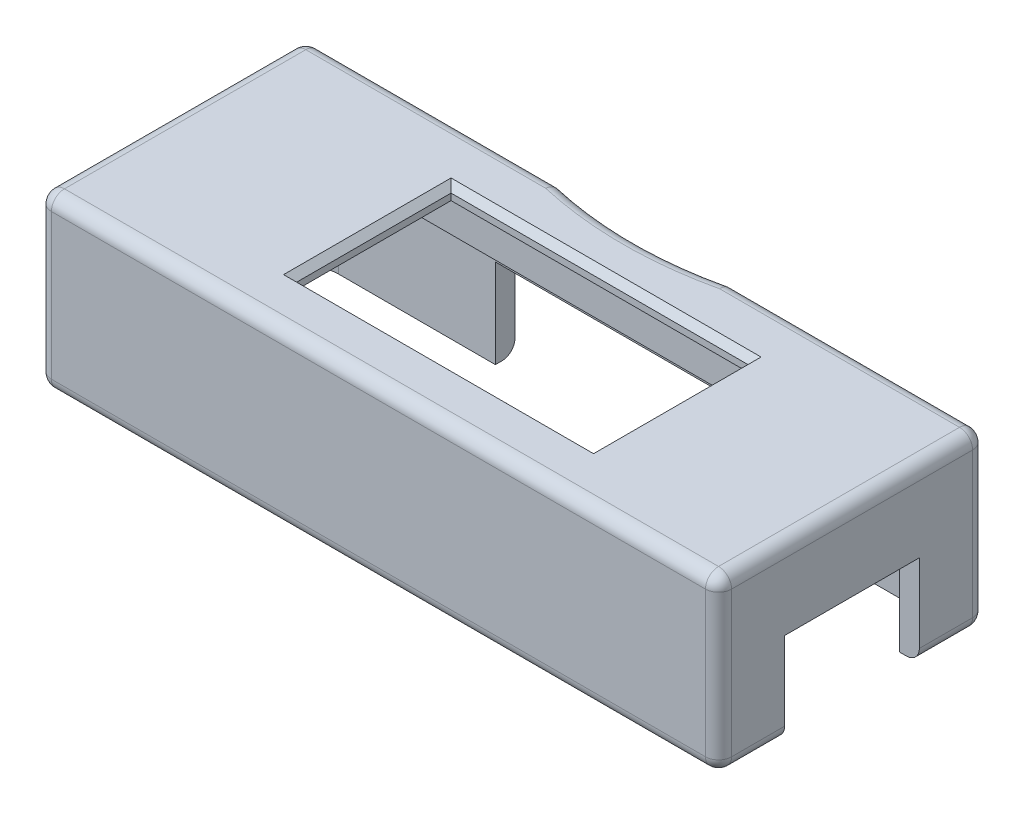
from build123d import *

# Parameters (mm, degrees)
EXTRUDE_1_DEPTH      = 13.1
CUT_EXTRUDE_1_DEPTH  = 1
CUT_EXTRUDE_2_DEPTH  = 3.5
CUT_EXTRUDE_3_DEPTH  = 11.5
SKETCH_7_R           = 1.2
CUT_EXTRUDE_4_DEPTH  = 3
CUT_EXTRUDE_5_DEPTH  = 3
SKETCH_17_W          = 10.3
SKETCH_17_H          = 7
CUT_EXTRUDE_7_DEPTH  = 3
SKETCH_23_R          = 28.905330341
CUT_EXTRUDE_16_DEPTH = 15
FILLET_1_R           = 1
FILLET_2_R           = 1
CHAMFER_1_SIZE       = 0.5
FILLET_3_R           = 1
SKETCH_24_W          = 2.140700812
SKETCH_24_H          = 3.70780257
CUT_EXTRUDE_17_DEPTH = 2
FILLET_4_R           = 1
CUT_EXTRUDE_18_DEPTH = 7
SKETCH_27_R          = 1.5
CUT_EXTRUDE_19_DEPTH = 2
CUT_EXTRUDE_20_DEPTH = 6.8


with BuildPart() as part:
    # 草图2 → 凸台-拉伸1 (new body)
    with BuildSketch(Plane(origin=(0, 0, 0), x_dir=(1, 0, 0), z_dir=(0, 1, 0))):
        Polygon((0.013768766, 20.433061971), (0, 0), (51.994397286, 0), (51.996083203, 20.418836971), align=None)
    extrude(amount=EXTRUDE_1_DEPTH)

    # 草图3 → 切除-拉伸1 (cut)
    with BuildSketch(Plane(origin=(0, 13.1, 0), x_dir=(1, 0, 0), z_dir=(0, 1, 0))):
        Polygon((15.554216141, 4.193063032), (38.254215601, 4.188106843), (38.256906278, 15.988112082), (15.556906819, 15.993072091), align=None)
    extrude(amount=-CUT_EXTRUDE_1_DEPTH, mode=Mode.SUBTRACT)

    # 草图4 → 切除-拉伸2 (cut)
    with BuildSketch(Plane(origin=(0, 12.1, 0), x_dir=(1, 0, 0), z_dir=(0, 1, 0))):
        Polygon((11.266979682, 17.10036488), (39.706985915, 17.101636261), (39.703966397, 3.081173841), (11.263967233, 3.087658824), align=None)
    extrude(amount=-CUT_EXTRUDE_2_DEPTH, mode=Mode.SUBTRACT)

    # 草图6 → 切除-拉伸3 (cut)
    with BuildSketch(Plane(origin=(0, 8.6, 0), x_dir=(1, 0, 0), z_dir=(0, 1, 0))):
        with BuildLine():
            Line((4.019496655, 18.931965744), (47.997410654, 18.919931154))
            ThreePointArc((47.997410654, 18.919931154), (49.765007767, 18.187296206), (50.496836532, 16.419365162))
            Line((50.496836532, 16.419365162), (50.493979096, 3.999425891))
            ThreePointArc((50.493979096, 3.999425891), (49.761344148, 2.231828778), (47.993413104, 1.500000013))
            Line((47.993413104, 1.500000013), (3.99352536, 1.500000013))
            ThreePointArc((3.99352536, 1.500000013), (2.225928247, 2.232634961), (1.494099482, 4.000566005))
            Line((1.494099482, 4.000566005), (1.518930662, 16.432539866))
            ThreePointArc((1.518930662, 16.432539866), (2.25156561, 18.200136979), (4.019496655, 18.931965744))
        make_face()
    extrude(amount=-CUT_EXTRUDE_3_DEPTH, mode=Mode.SUBTRACT)

    # 草图7 → 切除-拉伸4 (cut)
    with BuildSketch(Plane(origin=(0, 8.6, 0), x_dir=(1, 0, 0), z_dir=(0, 1, 0))):
        with Locations(Location((4.986997661, 16.769823075, 0), (0, 0, 270))):
            Circle(SKETCH_7_R)
        with Locations(Location((4.984007822, 3.657835416, 0), (0, 0, 270))):
            Circle(SKETCH_7_R)
        with Locations(Location((44.986916621, 16.760702161, 0), (0, 0, 270))):
            Circle(SKETCH_7_R)
        with Locations(Location((44.983926782, 3.648714502, 0), (0, 0, 270))):
            Circle(SKETCH_7_R)
    extrude(amount=CUT_EXTRUDE_4_DEPTH, mode=Mode.SUBTRACT)

    # 草图15 → 切除-拉伸5 (cut)
    with BuildSketch(Plane(origin=(0, 0, 0), x_dir=(-0.0006738472400635568, 0, 0.9999997729649228), z_dir=(-0.9999997729649228, 0, -0.0006738472400635568))):
        Polygon((-5.54, 3.59), (-10.21, 3.59), (-14.88, 3.59), (-14.88, 7.2), (-5.54, 7.2), align=None)
    extrude(amount=-CUT_EXTRUDE_5_DEPTH, mode=Mode.SUBTRACT)

    # 草图17 → 切除-拉伸7 (cut)
    with BuildSketch(Plane(origin=(50.493056282, 0, 0.011616857), x_dir=(-0.00023006840747121236, 0, 0.9999999735342636), z_dir=(-0.9999999735342636, 0, -0.00023006840747121236))):
        with Locations((-10.21, 3.5)):
            Rectangle(SKETCH_17_W, SKETCH_17_H)
    extrude(amount=-CUT_EXTRUDE_7_DEPTH, mode=Mode.SUBTRACT)

    # 草图23 → 切除-拉伸16 (cut)
    with BuildSketch(Plane(origin=(0, 13.1, 0), x_dir=(1, 0, 0), z_dir=(0, 1, 0))):
        with Locations((26.015215658, 48.580825692)):
            Circle(SKETCH_23_R)
    extrude(amount=-CUT_EXTRUDE_16_DEPTH, mode=Mode.SUBTRACT)

    # 圆角1
    fillet_1_edges = [part.edges().sort_by_distance(p)[0] for p in [
        (25.997198643, 13.1, 0),
        (9.738753423, 13.1, -20.430400722),
        (26.007305692, 13.1, -19.675496433),
        (51.995240244, 13.1, -10.209418486),
        (42.273683616, 13.1, -20.421497513),
        (0.006884383, 13.1, -10.216530986),
    ]]
    fillet(fillet_1_edges, radius=FILLET_1_R)

    # 圆角2
    # the kernel refuses this fillet: 1 mm, written as the material it takes off along each edge
    with BuildSketch(Plane(origin=(50.996000655, 12.1, -19.419110607), x_dir=(0.9999999965913674, 0, 8.256673242544318e-05), z_dir=(0, 1, 0))) as fillet_2_piece_1_section:
        Polygon((0, 0), (FILLET_2_R, 0), (FILLET_2_R, FILLET_2_R * 0.999808934229), (FILLET_2_R * 0.00019108402398, FILLET_2_R * 0.999999981743), align=None)
    fillet_2_piece_1 = extrude(amount=FILLET_2_R, mode=Mode.PRIVATE)
    fillet_2_piece_1 = fillet_2_piece_1 - Plane(origin=(50.996000655, 12.1, -19.419110607), x_dir=(-0.707232711871647, 0, 0.706980828070094), z_dir=(0, 1, 0)) * Sphere(FILLET_2_R, mode=Mode.PRIVATE)
    add(fillet_2_piece_1, mode=Mode.SUBTRACT)
    with BuildSketch(Plane(origin=(50.994479849, 12.1, -1), x_dir=(0, 0, 1), z_dir=(0, 1, 0))) as fillet_2_piece_2_section:
        Polygon((0, 0), (FILLET_2_R, 0), (FILLET_2_R, FILLET_2_R * 0.999917436676), (FILLET_2_R * 8.25667324293e-05, FILLET_2_R * 0.999999996591), align=None)
    fillet_2_piece_2 = extrude(amount=FILLET_2_R, mode=Mode.PRIVATE)
    fillet_2_piece_2 = fillet_2_piece_2 - Plane(origin=(50.994479849, 12.1, -1), x_dir=(-0.707077588835758, 0, -0.7071359723322034), z_dir=(0, 1, 0)) * Sphere(FILLET_2_R, mode=Mode.PRIVATE)
    add(fillet_2_piece_2, mode=Mode.SUBTRACT)
    with BuildSketch(Plane(origin=(1.013094961, 12.1, -19.432788467), x_dir=(-0.9999997729649228, 0, -0.0006738472400635567), z_dir=(0, 1, 0))) as fillet_2_piece_3_section:
        Polygon((0, 0), (FILLET_2_R, 0), (FILLET_2_R, -FILLET_2_R * 0.999599883524), (FILLET_2_R * 0.000400196522714, -FILLET_2_R * 0.999999919921), align=None)
    fillet_2_piece_3 = extrude(amount=FILLET_2_R, mode=Mode.PRIVATE)
    fillet_2_piece_3 = fillet_2_piece_3 - Plane(origin=(1.013094961, 12.1, -19.432788467), x_dir=(0.706771710700509, 0, 0.7074416929708596), z_dir=(0, 1, 0)) * Sphere(FILLET_2_R, mode=Mode.PRIVATE)
    add(fillet_2_piece_3, mode=Mode.SUBTRACT)
    with BuildSketch(Plane(origin=(1.000674074, 12.1, -1), x_dir=(-0.9999997729649228, 0, -0.0006738472400635567), z_dir=(0, 1, 0))) as fillet_2_piece_4_section:
        Polygon((0, 0), (FILLET_2_R, 0), (FILLET_2_R, FILLET_2_R * 1.00067407443), (-FILLET_2_R * 0.000673847240067, FILLET_2_R * 0.999999772965), align=None)
    fillet_2_piece_4 = extrude(amount=FILLET_2_R, mode=Mode.PRIVATE)
    fillet_2_piece_4 = fillet_2_piece_4 - Plane(origin=(1.000674074, 12.1, -1), x_dir=(0.707344982042023, 0, -0.7068685000620484), z_dir=(0, 1, 0)) * Sphere(FILLET_2_R, mode=Mode.PRIVATE)
    add(fillet_2_piece_4, mode=Mode.SUBTRACT)
    with BuildSketch(Plane(origin=(0, -2.501685186, 0), x_dir=(0.0006738472400635051, 0, -0.9999997729649227), z_dir=(0, 1, 0))) as fillet_2_piece_5:
        with BuildLine():
            CenterArc((FILLET_2_R * 1.00067407443, -FILLET_2_R), FILLET_2_R, 90, 90.038608606)
            Line((FILLET_2_R * 0.000674301463259, -FILLET_2_R * 1.00067384724), (0, 0))
            Line((0, 0), (FILLET_2_R * 1.00067407443, 0))
        make_face()
    extrude(amount=14.601685186, mode=Mode.SUBTRACT)
    with BuildSketch(Plane(origin=(0.013768766, -2.498999709, -20.433061971), x_dir=(-0.0006738472400636408, 0, 0.9999997729649228), z_dir=(0, 1, 0))) as fillet_2_piece_6:
        with BuildLine():
            CenterArc((FILLET_2_R * 0.999599883524, FILLET_2_R), FILLET_2_R, 180.022929572, 89.977070428)
            Line((-FILLET_2_R * 0.000400036397496, FILLET_2_R * 0.999599803477), (0, 0))
            Line((0, 0), (FILLET_2_R * 0.999599883524, 0))
        make_face()
    extrude(amount=14.598999709, mode=Mode.SUBTRACT)
    with BuildSketch(Plane(origin=(51.994397286, -2.499793592, 0), x_dir=(-1, 0, 0), z_dir=(0, 1, 0))) as fillet_2_piece_7:
        with BuildLine():
            CenterArc((FILLET_2_R * 0.999917436676, -FILLET_2_R), FILLET_2_R, 90, 89.995269275)
            Line((-FILLET_2_R * 8.2559915445e-05, -FILLET_2_R * 0.999917433268), (0, 0))
            Line((0, 0), (FILLET_2_R * 0.999917436676, 0))
        make_face()
    extrude(amount=14.599793592, mode=Mode.SUBTRACT)
    with BuildSketch(Plane(origin=(51.996083203, -2.499522336, -20.418836971), x_dir=(-8.256673242407848e-05, 0, 0.9999999965913674), z_dir=(0, 1, 0))) as fillet_2_piece_8:
        with BuildLine():
            CenterArc((FILLET_2_R * 0.999808934229, -FILLET_2_R), FILLET_2_R, 90, 89.989051692)
            Line((-FILLET_2_R * 0.000191047514369, -FILLET_2_R * 0.999808915976), (0, 0))
            Line((0, 0), (FILLET_2_R * 0.999808934229, 0))
        make_face()
    extrude(amount=14.599522336, mode=Mode.SUBTRACT)

    # 倒角1
    chamfer_1_edges = [part.edges().sort_by_distance(p)[0] for p in [
        (15.55556148, 13.1, -10.093067561),
        (26.904215871, 13.1, -4.190584937),
        (38.25556094, 13.1, -10.088109463),
        (26.906906548, 13.1, -15.990592087),
    ]]
    chamfer(chamfer_1_edges, length=CHAMFER_1_SIZE)

    # 圆角3
    # the kernel refuses this fillet: 1 mm, written as the material it takes off along each edge
    with BuildSketch(Plane(origin=(51.995458107, 0, -12.848037855), x_dir=(0, 1, 0), z_dir=(8.256673242544318e-05, 0, -0.9999999965913674))) as fillet_3_piece_1:
        with BuildLine():
            CenterArc((FILLET_3_R, -FILLET_3_R), FILLET_3_R, 90, 90)
            Line((0, -FILLET_3_R), (0, 0))
            Line((0, 0), (FILLET_3_R, 0))
        make_face()
    extrude(amount=6.570990208, mode=Mode.SUBTRACT)
    with BuildSketch(Plane(origin=(21.963737986, 0, -20.427055345), x_dir=(0, 1, 0), z_dir=(-0.9999999625576317, 0, -0.0002736507542471488))) as fillet_3_piece_2:
        with BuildLine():
            CenterArc((FILLET_3_R, -FILLET_3_R), FILLET_3_R, 90, 90)
            Line((0, -FILLET_3_R), (0, 0))
            Line((0, 0), (FILLET_3_R, 0))
        make_face()
    extrude(amount=20.950370159, mode=Mode.SUBTRACT)
    with BuildSketch(Plane(origin=(26.015215658, 0, -48.580825692), x_dir=(-0.309941939695479, 0, 0.9507554859256947), z_dir=(-0.9507554859256947, 0, -0.309941939695479))) as fillet_3_piece_3:
        with BuildLine():
            CenterArc((28.905330341 + FILLET_3_R, FILLET_3_R), FILLET_3_R, 180, 90)
            Line((28.905330341 + FILLET_3_R, 0), (28.905330341, 0))
            Line((28.905330341, 0), (28.905330341, FILLET_3_R))
        make_face()
    revolve(axis=Axis((26.015215658, 0, -48.580825692), (0, 1, 0)), revolution_arc=36.08010502, mode=Mode.SUBTRACT)
    with BuildSketch(Plane(origin=(50.996274306, 0, -20.41911057), x_dir=(0, 1, 0), z_dir=(-0.9999999625576317, 0, -0.0002736507542471488))) as fillet_3_piece_4:
        with BuildLine():
            CenterArc((FILLET_3_R, -FILLET_3_R), FILLET_3_R, 90, 90)
            Line((0, -FILLET_3_R), (0, 0))
            Line((0, 0), (FILLET_3_R, 0))
        make_face()
    extrude(amount=20.944990968, mode=Mode.SUBTRACT)
    with BuildSketch(Plane(origin=(51.994479846, 0, -0.999917433), x_dir=(0, 1, 0), z_dir=(8.256673242544318e-05, 0, -0.9999999965913674))) as fillet_3_piece_5:
        with BuildLine():
            CenterArc((FILLET_3_R, -FILLET_3_R), FILLET_3_R, 90, 90)
            Line((0, -FILLET_3_R), (0, 0))
            Line((0, 0), (FILLET_3_R, 0))
        make_face()
    extrude(amount=6.54812035, mode=Mode.SUBTRACT)
    with BuildSketch(Plane(origin=(1.000674074, 0, 0), x_dir=(0, 1, 0), z_dir=(1, 0, 0))) as fillet_3_piece_6:
        with BuildLine():
            CenterArc((FILLET_3_R, -FILLET_3_R), FILLET_3_R, 90, 90)
            Line((0, -FILLET_3_R), (0, 0))
            Line((0, 0), (FILLET_3_R, 0))
        make_face()
    extrude(amount=49.993805775, mode=Mode.SUBTRACT)
    with BuildSketch(Plane(origin=(0.013095188, 0, -19.433462315), x_dir=(0, 1, 0), z_dir=(-0.0006738472400635567, 0, 0.9999997729649228))) as fillet_3_piece_7:
        with BuildLine():
            CenterArc((FILLET_3_R, -FILLET_3_R), FILLET_3_R, 90, 90)
            Line((0, -FILLET_3_R), (0, 0))
            Line((0, 0), (FILLET_3_R, 0))
        make_face()
    extrude(amount=18.432792652, mode=Mode.SUBTRACT)
    with BuildSketch(Plane(origin=(1.013094961, 0, -19.432788467), x_dir=(-0.9999997729649229, 0, -0.0006738472400016349), z_dir=(-0.0006738472400016349, 0, 0.9999997729649229))) as fillet_3_piece_8:
        with BuildLine():
            CenterArc((1 - FILLET_3_R, -FILLET_3_R), FILLET_3_R, 0, 90)
            Line((1, -FILLET_3_R), (1, 0))
            Line((1, 0), (1 - FILLET_3_R, 0))
        make_face()
    revolve(axis=Axis((1.013094961, 0, -19.432788467), (0, -1, 0)), revolution_arc=89.977070428, mode=Mode.SUBTRACT)
    with BuildSketch(Plane(origin=(1.000674074, 0, -1), x_dir=(0, 0, 1), z_dir=(1, 0, 0))) as fillet_3_piece_9:
        with BuildLine():
            CenterArc((1 - FILLET_3_R, -FILLET_3_R), FILLET_3_R, 0, 90)
            Line((1, -FILLET_3_R), (1, 0))
            Line((1, 0), (1 - FILLET_3_R, 0))
        make_face()
    revolve(axis=Axis((1.000674074, 0, -1), (0, -1, 0)), revolution_arc=90.038608606, mode=Mode.SUBTRACT)
    with BuildSketch(Plane(origin=(50.994479849, 0, -1), x_dir=(0.9999999965913675, 0, 8.256673243356417e-05), z_dir=(8.256673243356417e-05, 0, -0.9999999965913675))) as fillet_3_piece_10:
        with BuildLine():
            CenterArc((1 - FILLET_3_R, -FILLET_3_R), FILLET_3_R, 0, 90)
            Line((1 - FILLET_3_R, 0), (1, 0))
            Line((1, 0), (1, -FILLET_3_R))
        make_face()
    revolve(axis=Axis((50.994479849, 0, -1), (0, -1, 0)), revolution_arc=89.995269275, mode=Mode.SUBTRACT)
    with BuildSketch(Plane(origin=(50.996000655, 0, -19.419110607), x_dir=(0.0002736507538187996, 0, -0.9999999625576318), z_dir=(-0.9999999625576318, 0, -0.0002736507538187996))) as fillet_3_piece_11:
        with BuildLine():
            CenterArc((1 - FILLET_3_R, -FILLET_3_R), FILLET_3_R, 0, 90)
            Line((1, -FILLET_3_R), (1, 0))
            Line((1, 0), (1 - FILLET_3_R, 0))
        make_face()
    revolve(axis=Axis((50.996000655, 0, -19.419110607), (0, -1, 0)), revolution_arc=89.989051692, mode=Mode.SUBTRACT)

    # 草图24 → 切除-拉伸17 (cut)
    with BuildSketch(Plane(origin=(0, 8.6, 0), x_dir=(1, 0, 0), z_dir=(0, 1, 0))):
        with Locations((8.462622832, 16.045923285)):
            Rectangle(SKETCH_24_W, SKETCH_24_H)
    extrude(amount=CUT_EXTRUDE_17_DEPTH, mode=Mode.SUBTRACT)

    # 圆角4
    fillet_4_edges = [part.edges().sort_by_distance(p)[0] for p in [
        (0.750452697, 7.2, -5.539495567),
        (0.750452697, 3.59, -5.539495567),
        (0.762927244, 3.59, -14.879489282),
        (0.762927244, 7.2, -14.879489282),
    ]]
    fillet(fillet_4_edges, radius=FILLET_4_R)

    # 草图26 → 切除-拉伸18 (cut)
    with BuildSketch(Plane(origin=(0, 12.1, 0), x_dir=(1, 0, 0), z_dir=(0, 1, 0))):
        Polygon((10.766919033, 17.250342525), (39.906938681, 17.251645191), (39.904017699, 2.931239843), (10.76374648, 2.937682491), align=None)
    extrude(amount=-CUT_EXTRUDE_18_DEPTH, mode=Mode.SUBTRACT)

    # 草图27 → 切除-拉伸19 (cut)
    with BuildSketch(Plane(origin=(0, 8.6, 0), x_dir=(1, 0, 0), z_dir=(0, 1, 0))):
        with Locations(Location((48.456693563, 15.689986743, 0), (0, 0, 270))):
            Circle(SKETCH_27_R)
        with Locations(Location((48.454185312, 4.690009029, 0), (0, 0, 270))):
            Circle(SKETCH_27_R)
    extrude(amount=CUT_EXTRUDE_19_DEPTH, mode=Mode.SUBTRACT)

    # 草图28 → 切除-拉伸20 (cut)
    with BuildSketch(Plane(origin=(0, 0, 0), x_dir=(1, 0, 0), z_dir=(0, 1, 0))):
        Polygon((36.008795325, 20.423211905), (36.008407686, 18.723211947), (16.008408414, 18.728684962), (16.008796053, 20.42868492), align=None)
    extrude(amount=CUT_EXTRUDE_20_DEPTH, mode=Mode.SUBTRACT)


solid = part.part
